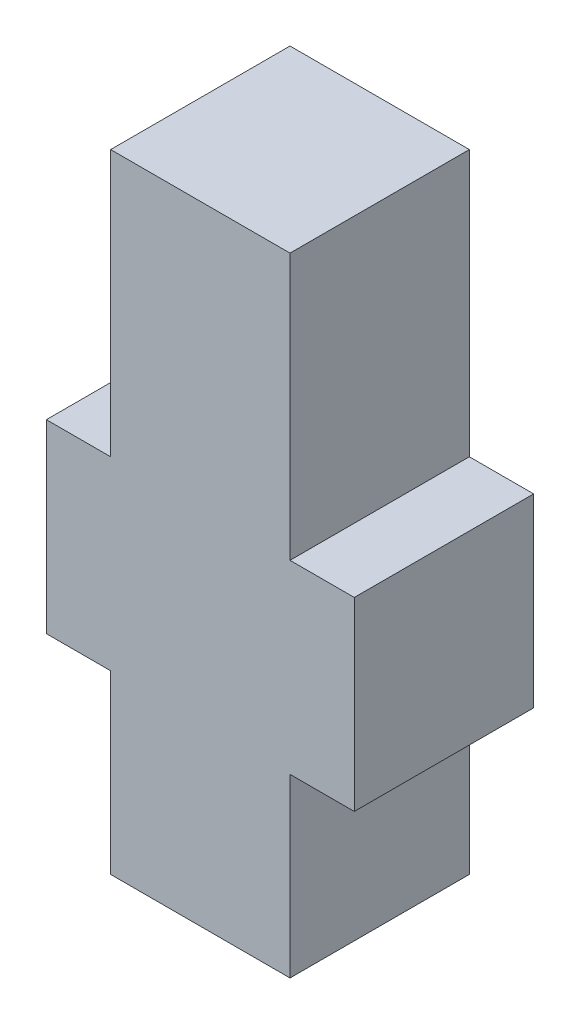
from build123d import *

# Parameters (mm, degrees)
SKETCH_6_W             = 6
SKETCH_6_H             = 21
EXTRUDE_1420_DEPTH     = 6
SKETCH_1469_W          = 10.3
SKETCH_1469_H          = 6.2
EXTRUDE_10_3_6_2_DEPTH = 6


with BuildPart() as part:
    # Канал_6 → Extrude 1420 (new body)
    with BuildSketch(Plane.XY):
        with Locations((0, -10.5)):
            Rectangle(SKETCH_6_W, SKETCH_6_H)
    extrude(amount=EXTRUDE_1420_DEPTH)

    # Sketch 1469 → Гайка_10_3х6_2 (add)
    with BuildSketch(Plane.XY):
        with Locations((0, -12)):
            Rectangle(SKETCH_1469_W, SKETCH_1469_H)
    extrude(amount=EXTRUDE_10_3_6_2_DEPTH)


solid = part.part
